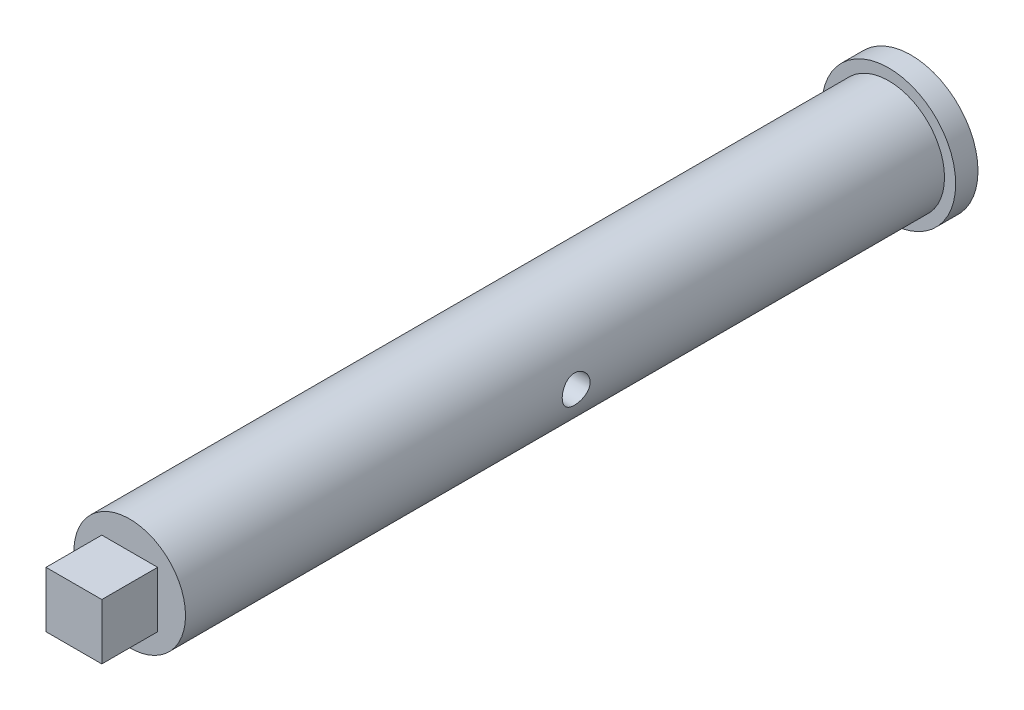
from build123d import *

# Parameters (mm, degrees)
SKETCH6_R               = 6
BOSS_EXTRUDE4_DEPTH     = 2
SKETCH1_R               = 5
BOSS_EXTRUDE1_DEPTH     = 68
SKETCH2_W               = 5
SKETCH2_H               = 5
BOSS_EXTRUDE2_DEPTH     = 5
CUT_EXTRUDE1_DEPTH      = 5
CUT_EXTRUDE1_DEPTH_BACK = 5
SKETCH5_R               = 1.25


with BuildPart() as part:
    # Sketch6 → Boss-Extrude4 (new body)
    with BuildSketch(Plane.XY):
        Circle(SKETCH6_R)
    extrude(amount=BOSS_EXTRUDE4_DEPTH)

    # Sketch1 → Boss-Extrude1 (add)
    with BuildSketch(Plane.XY.offset(2)):
        Circle(SKETCH1_R)
    extrude(amount=BOSS_EXTRUDE1_DEPTH)

    # Sketch2 → Boss-Extrude2 (add)
    with BuildSketch(Plane.XY.offset(70)):
        Rectangle(SKETCH2_W, SKETCH2_H)
    extrude(amount=BOSS_EXTRUDE2_DEPTH)

    # Sketch5 → Cut-Extrude1 (cut, two sides: drawn at the far end of the back side and taken through both)
    with BuildSketch(Plane(origin=(0, 0, 0), x_dir=(0, 0, -1), z_dir=(1, 0, 0)).offset(-CUT_EXTRUDE1_DEPTH_BACK)):
        with Locations((-35, 0)):
            Circle(SKETCH5_R)
    extrude(amount=CUT_EXTRUDE1_DEPTH + CUT_EXTRUDE1_DEPTH_BACK, mode=Mode.SUBTRACT)


solid = part.part
